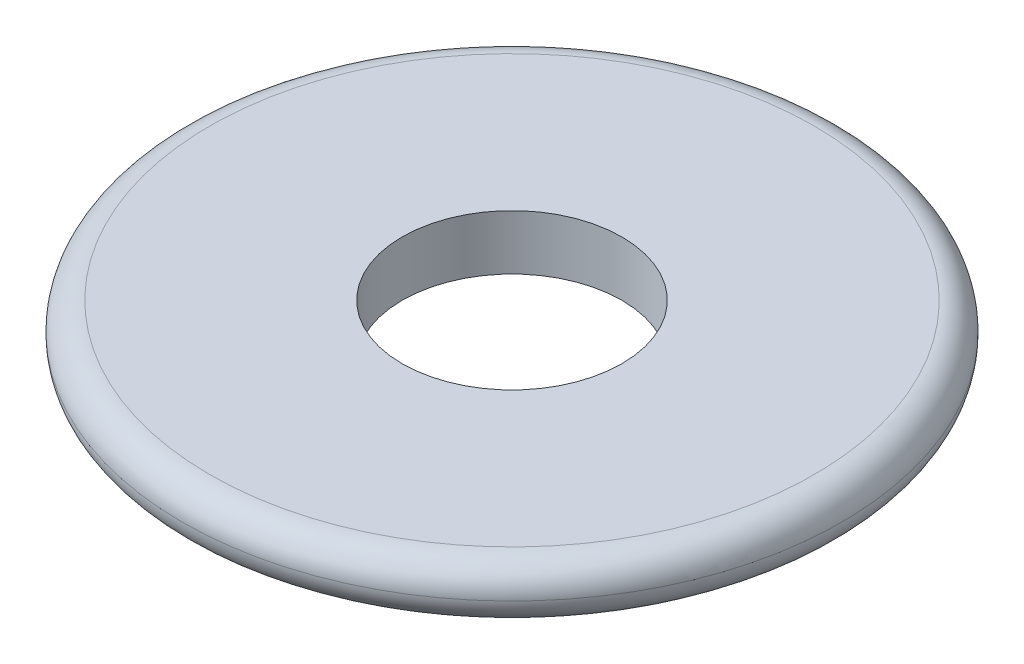
from build123d import *

# Parameters (mm, degrees)
SKETCH_1_R      = 12
SKETCH_1_R_2    = 4
EXTRUDE_1_DEPTH = 1
FILLET_1_R      = 1


with BuildPart() as part:
    # 草图1 → 凸台-拉伸1 (new, symmetric)
    with BuildSketch(Plane(origin=(0, 0, 0), x_dir=(1, 0, 0), z_dir=(0, 1, 0))):
        with Locations(Location((0, 0, 0), (0, 0, 270))):
            Circle(SKETCH_1_R)
        with Locations(Location((0, 0, 0), (0, 0, 270))):
            Circle(SKETCH_1_R_2, mode=Mode.SUBTRACT)
    extrude(amount=EXTRUDE_1_DEPTH, both=True)

    # 圆角1
    fillet_1_edges = [part.edges().sort_by_distance(p)[0] for p in [
        (0, -1, -12),
        (0, 1, -12),
    ]]
    fillet(fillet_1_edges, radius=FILLET_1_R - 0.0001)  # a hair under: the kernel refuses the full size


solid = part.part
